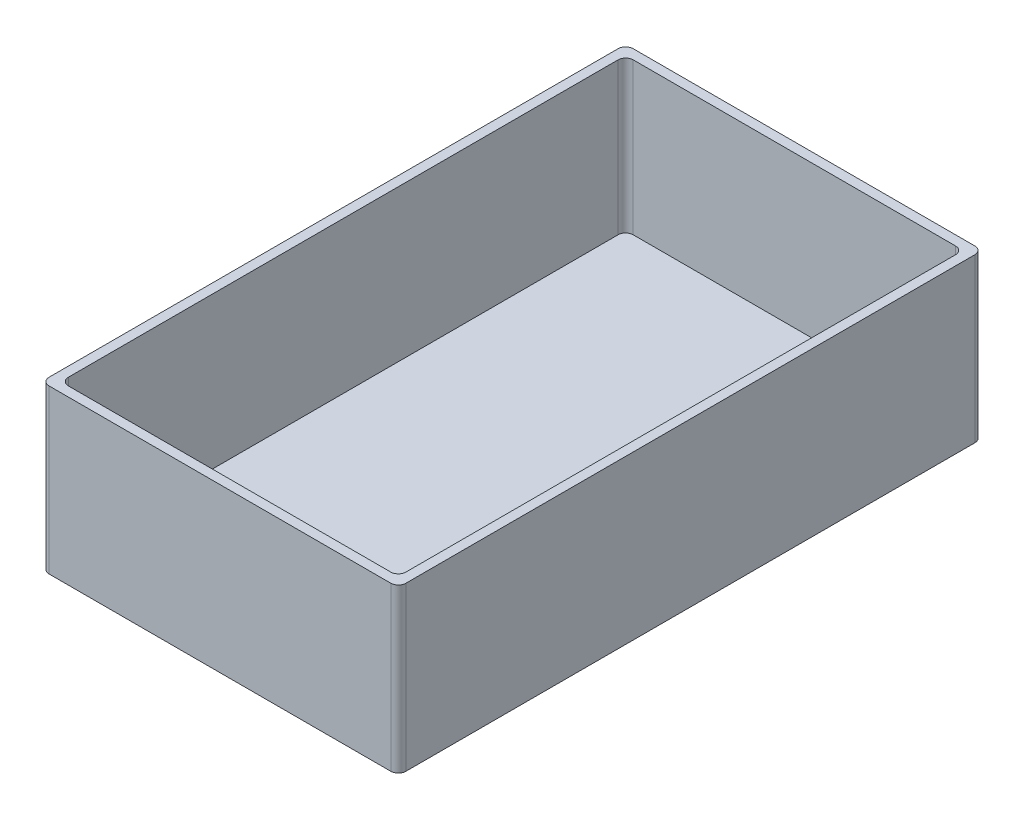
from build123d import *

# Parameters (mm, degrees)
SKETCH1_W           = 47.09116882
SKETCH1_H           = 77.09116882
BOSS_EXTRUDE1_DEPTH = 1.5
SKETCH2_W           = 47.09116882
SKETCH2_H           = 77.09116882
SKETCH2_W_2         = 44.545584412
SKETCH2_H_2         = 74.545584412
BOSS_EXTRUDE2_DEPTH = 20
FILLET4_R           = 1


with BuildPart() as part:
    # Sketch1 → Boss-Extrude1 (new body)
    with BuildSketch(Plane(origin=(0, 0, 0), x_dir=(1, 0, 0), z_dir=(0, 1, 0))):
        with Locations((23.54558441, -38.54558441)):
            Rectangle(SKETCH1_W, SKETCH1_H)
    extrude(amount=BOSS_EXTRUDE1_DEPTH)

    # Sketch2 → Boss-Extrude2 (add)
    with BuildSketch(Plane(origin=(0, 1.5, 0), x_dir=(1, 0, 0), z_dir=(0, 1, 0))):
        with Locations((23.54558441, -38.54558441)):
            Rectangle(SKETCH2_W, SKETCH2_H)
        with Locations((23.545584412, -38.545584412)):
            Rectangle(SKETCH2_W_2, SKETCH2_H_2, mode=Mode.SUBTRACT)
    extrude(amount=BOSS_EXTRUDE2_DEPTH)

    # Fillet4
    fillet4_edges = [part.edges().sort_by_distance(p)[0] for p in [
        (45.818376618, 11.5, 1.272792206),
        (1.272792206, 11.5, 1.272792206),
        (45.818376618, 11.5, 75.818376618),
        (1.272792206, 11.5, 75.818376618),
        (47.09116882, 10.75, 0),
        (0, 10.75, 0),
        (47.09116882, 10.75, 77.09116882),
        (0, 10.75, 77.09116882),
    ]]
    fillet(fillet4_edges, radius=FILLET4_R)


solid = part.part
